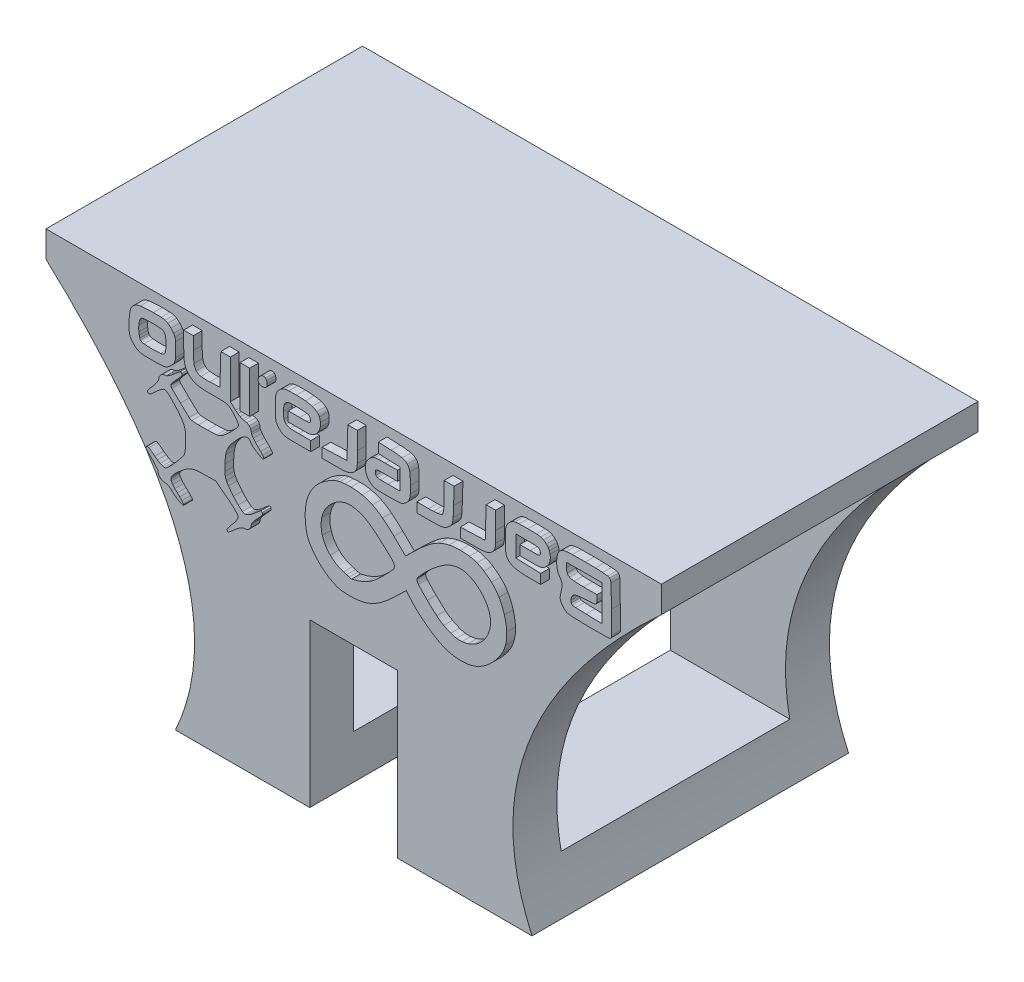
from build123d import *

# Parameters (mm, degrees)
CROQUIS1_W              = 30
CROQUIS1_H              = 18.5
SALIENTE_EXTRUIR1_DEPTH = 13
VACIADO2_T              = 2.5
CROQUIS2_W              = 5
CROQUIS2_H              = 9.25
CORTAR_EXTRUIR1_DEPTH   = 33
CROQUIS3_W              = 35
CROQUIS3_H              = 18
SALIENTE_EXTRUIR2_DEPTH = 1.5
CROQUIS4_W              = 13
CROQUIS4_H              = 17
CORTAR_EXTRUIR2_DEPTH   = 36.5
SALIENTE_EXTRUIR3_DEPTH = 0.5


with BuildPart() as part:
    # Croquis1 → Saliente-Extruir1 (new body)
    with BuildSketch(Plane.XY):
        Rectangle(CROQUIS1_W, CROQUIS1_H)
    extrude(amount=SALIENTE_EXTRUIR1_DEPTH)

    # Vaciado2
    vaciado2_openings = [part.faces().sort_by_distance(p)[0] for p in [
        (0, 9.25, 6.5),
    ]]
    offset(amount=VACIADO2_T, openings=vaciado2_openings, kind=Kind.INTERSECTION)

    # Croquis2 → Cortar-Extruir1 (cut)
    with BuildSketch(Plane(origin=(0, 0, -2.5), x_dir=(-1, 0, 0), z_dir=(0, 0, -1))):
        with Locations((0, -7.125)):
            Rectangle(CROQUIS2_W, CROQUIS2_H)
        with BuildLine():
            add(Edge.make_bspline(
                [(17.5, 7.75), (6.020580463, -2.775983449), (10.140099404, -11.75)],
                knots=[0, 0, 0, 0.85894238, 0.85894238, 0.85894238], degree=2))
            Line((10.140099404, -11.75), (17.5, -11.75))
            Line((17.5, -11.75), (17.5, 7.75))
        make_face()
        with BuildLine():
            Line((-17.5, -11.75), (-10.140099404, -11.75))
            add(Edge.make_bspline(
                [(-17.5, 7.75), (-6.020580463, -2.775983449), (-10.140099404, -11.75)],
                knots=[0, 0, 0, 0.85894238, 0.85894238, 0.85894238], degree=2))
            Line((-17.5, 7.75), (-17.5, -11.75))
        make_face()
    extrude(amount=-CORTAR_EXTRUIR1_DEPTH, mode=Mode.SUBTRACT)

    # Croquis3 → Saliente-Extruir2 (add)
    with BuildSketch(Plane(origin=(0, 9.25, 0), x_dir=(1, 0, 0), z_dir=(0, 1, 0))):
        with Locations((0, -6.5)):
            Rectangle(CROQUIS3_W, CROQUIS3_H)
    extrude(amount=-SALIENTE_EXTRUIR2_DEPTH)

    # Croquis4 → Cortar-Extruir2 (cut)
    with BuildSketch(Plane.ZY.offset(17.5)):
        with Locations((6.5, -0.75)):
            Rectangle(CROQUIS4_W, CROQUIS4_H)
    extrude(amount=-CORTAR_EXTRUIR2_DEPTH, mode=Mode.SUBTRACT)

    # Croquis5 → Saliente-Extruir3 (add)
    # profile 1 of 12: a face of its own
    with BuildSketch(Plane.XY.offset(15.5)):
        with BuildLine():
            Line((-6.726430196, 1.686888291), (-7.347587786, 2.160491987))
            Line((-7.347587786, 2.160491987), (-8.012612343, 2.150111901))
            ThreePointArc((-8.012612343, 2.150111901), (-8.249503026, 2.14025315), (-8.485561695, 2.1181015))
            ThreePointArc((-8.485561695, 2.1181015), (-8.648540759, 2.086370976), (-8.805198901, 2.031350726))
            ThreePointArc((-8.805198901, 2.031350726), (-8.96281718, 1.950373747), (-9.108788937, 1.849909626))
            ThreePointArc((-9.108788937, 1.849909626), (-9.328394875, 1.670920525), (-9.54180644, 1.484589178))
            ThreePointArc((-9.54180644, 1.484589178), (-9.612029303, 1.417976061), (-9.678931419, 1.348028476))
            ThreePointArc((-9.678931419, 1.348028476), (-9.738891455, 1.278335907), (-9.794803729, 1.205355924))
            ThreePointArc((-9.794803729, 1.205355924), (-9.837977704, 1.141728708), (-9.877364265, 1.075689981))
            ThreePointArc((-9.877364265, 1.075689981), (-9.894272975, 1.0335316), (-9.900032698, 0.988475423))
            ThreePointArc((-9.900032698, 0.988475423), (-9.894185201, 0.943216208), (-9.877026669, 0.900929396))
            ThreePointArc((-9.877026669, 0.900929396), (-9.836694506, 0.834050075), (-9.792590698, 0.769595587))
            ThreePointArc((-9.792590698, 0.769595587), (-9.73546608, 0.695501681), (-9.674284529, 0.624720702))
            ThreePointArc((-9.674284529, 0.624720702), (-9.605936838, 0.553469752), (-9.534272698, 0.485555423))
            ThreePointArc((-9.534272698, 0.485555423), (-9.463444228, 0.420052787), (-9.394159644, 0.352919234))
            ThreePointArc((-9.394159644, 0.352919234), (-9.334033523, 0.2913043), (-9.275954698, 0.227755888))
            ThreePointArc((-9.275954698, 0.227755888), (-9.229944999, 0.174390027), (-9.185293859, 0.119882383))
            ThreePointArc((-9.185293859, 0.119882383), (-9.172829293, 0.097350582), (-9.168512698, 0.071965262))
            ThreePointArc((-9.168512698, 0.071965262), (-9.186172515, 0.038125782), (-9.2240315, 0.033259899))
            ThreePointArc((-9.2240315, 0.033259899), (-9.328133027, 0.076013859), (-9.428836343, 0.126252002))
            ThreePointArc((-9.428836343, 0.126252002), (-9.548674314, 0.197072608), (-9.663347482, 0.275982441))
            ThreePointArc((-9.663347482, 0.275982441), (-9.758691073, 0.354145977), (-9.8458406, 0.441352047))
            ThreePointArc((-9.8458406, 0.441352047), (-9.884556396, 0.480126129), (-9.926885883, 0.514919185))
            ThreePointArc((-9.926885883, 0.514919185), (-9.975363087, 0.548008936), (-10.026327432, 0.577122616))
            ThreePointArc((-10.026327432, 0.577122616), (-10.076392804, 0.600545377), (-10.128226156, 0.619740971))
            ThreePointArc((-10.128226156, 0.619740971), (-10.17154802, 0.630109082), (-10.215956801, 0.633593583))
            ThreePointArc((-10.215956801, 0.633593583), (-10.295973509, 0.640353485), (-10.373722074, 0.660441556))
            ThreePointArc((-10.373722074, 0.660441556), (-10.44475892, 0.692905233), (-10.508698761, 0.737758556))
            ThreePointArc((-10.508698761, 0.737758556), (-10.559750331, 0.790552611), (-10.599429644, 0.85235089))
            ThreePointArc((-10.599429644, 0.85235089), (-10.623409168, 0.917255705), (-10.631552698, 0.985967681))
            ThreePointArc((-10.631552698, 0.985967681), (-10.637077188, 1.023601814), (-10.653184476, 1.058060532))
            ThreePointArc((-10.653184476, 1.058060532), (-10.698147326, 1.12333131), (-10.745709869, 1.186732705))
            ThreePointArc((-10.745709869, 1.186732705), (-10.806935048, 1.261586789), (-10.87135867, 1.333706503))
            ThreePointArc((-10.87135867, 1.333706503), (-10.944509659, 1.409493154), (-11.020172698, 1.482771991))
            ThreePointArc((-11.020172698, 1.482771991), (-11.164219655, 1.624416162), (-11.301171933, 1.772931045))
            ThreePointArc((-11.301171933, 1.772931045), (-11.321206676, 1.834012271), (-11.290947387, 1.890728076))
            ThreePointArc((-11.290947387, 1.890728076), (-11.222172075, 1.916701583), (-11.151339447, 1.897018966))
            ThreePointArc((-11.151339447, 1.897018966), (-10.979405574, 1.776962483), (-10.813036318, 1.64930636))
            ThreePointArc((-10.813036318, 1.64930636), (-10.740048208, 1.593270301), (-10.664646389, 1.540526867))
            ThreePointArc((-10.664646389, 1.540526867), (-10.589056137, 1.492708095), (-10.511244999, 1.448595194))
            ThreePointArc((-10.511244999, 1.448595194), (-10.443093644, 1.414231989), (-10.373336563, 1.383258022))
            ThreePointArc((-10.373336563, 1.383258022), (-10.328694271, 1.36969383), (-10.28226214, 1.365113583))
            ThreePointArc((-10.28226214, 1.365113583), (-10.204801303, 1.378938579), (-10.13690555, 1.418706384))
            ThreePointArc((-10.13690555, 1.418706384), (-10.007450004, 1.534101515), (-9.883090695, 1.654971433))
            ThreePointArc((-9.883090695, 1.654971433), (-9.721067406, 1.826245665), (-9.566168616, 2.003989227))
            ThreePointArc((-9.566168616, 2.003989227), (-9.370999793, 2.241873087), (-9.180307818, 2.483360501))
            ThreePointArc((-9.180307818, 2.483360501), (-9.149373135, 2.532818732), (-9.128894581, 2.587441989))
            ThreePointArc((-9.128894581, 2.587441989), (-9.10740439, 2.678353684), (-9.090749379, 2.770274166))
            ThreePointArc((-9.090749379, 2.770274166), (-9.075591326, 2.886819399), (-9.065918756, 3.003947531))
            ThreePointArc((-9.065918756, 3.003947531), (-9.059846744, 3.141257884), (-9.057822201, 3.278687515))
            ThreePointArc((-9.057822201, 3.278687515), (-9.060169294, 3.448186799), (-9.0672087, 3.617556109))
            ThreePointArc((-9.0672087, 3.617556109), (-9.078395109, 3.734045059), (-9.09893582, 3.84925309))
            ThreePointArc((-9.09893582, 3.84925309), (-9.125052934, 3.943642311), (-9.161037844, 4.034727517))
            ThreePointArc((-9.161037844, 4.034727517), (-9.208933013, 4.128503258), (-9.264670728, 4.217840506))
            ThreePointArc((-9.264670728, 4.217840506), (-9.391358994, 4.39350335), (-9.526398434, 4.56283055))
            ThreePointArc((-9.526398434, 4.56283055), (-9.672407828, 4.729280787), (-9.82580573, 4.888947653))
            ThreePointArc((-9.82580573, 4.888947653), (-9.964686603, 5.022163252), (-10.108320125, 5.150240196))
            ThreePointArc((-10.108320125, 5.150240196), (-10.178012497, 5.1913099), (-10.257634879, 5.205593583))
            ThreePointArc((-10.257634879, 5.205593583), (-10.295597991, 5.20065198), (-10.331031024, 5.186156548))
            ThreePointArc((-10.331031024, 5.186156548), (-10.393492967, 5.148712777), (-10.454226307, 5.108525817))
            ThreePointArc((-10.454226307, 5.108525817), (-10.525338304, 5.056700733), (-10.593995822, 5.001665284))
            ThreePointArc((-10.593995822, 5.001665284), (-10.665004686, 4.939713912), (-10.73364683, 4.875150088))
            ThreePointArc((-10.73364683, 4.875150088), (-10.88865626, 4.730140501), (-11.049732599, 4.591901155))
            ThreePointArc((-11.049732599, 4.591901155), (-11.117782387, 4.565180588), (-11.188559824, 4.583492241))
            ThreePointArc((-11.188559824, 4.583492241), (-11.22369964, 4.635679308), (-11.209351086, 4.696936271))
            ThreePointArc((-11.209351086, 4.696936271), (-11.083235549, 4.857848652), (-10.949755303, 5.012706481))
            ThreePointArc((-10.949755303, 5.012706481), (-10.88005007, 5.092961376), (-10.813535032, 5.175879515))
            ThreePointArc((-10.813535032, 5.175879515), (-10.753068258, 5.258047944), (-10.696293133, 5.342809178))
            ThreePointArc((-10.696293133, 5.342809178), (-10.651528671, 5.416472551), (-10.610050765, 5.492035326))
            ThreePointArc((-10.610050765, 5.492035326), (-10.591648549, 5.538326045), (-10.582967975, 5.58737826))
            ThreePointArc((-10.582967975, 5.58737826), (-10.570863279, 5.656240743), (-10.545258667, 5.721302015))
            ThreePointArc((-10.545258667, 5.721302015), (-10.506707491, 5.781531892), (-10.457582338, 5.833498713))
            ThreePointArc((-10.457582338, 5.833498713), (-10.398143986, 5.87672159), (-10.331877301, 5.908499904))
            ThreePointArc((-10.331877301, 5.908499904), (-10.2598337, 5.928442445), (-10.185435318, 5.935713362))
            ThreePointArc((-10.185435318, 5.935713362), (-10.149327985, 5.940777687), (-10.115686532, 5.954836118))
            ThreePointArc((-10.115686532, 5.954836118), (-10.050741673, 5.993934329), (-9.987231894, 6.035322886))
            ThreePointArc((-9.987231894, 6.035322886), (-9.91219059, 6.088314191), (-9.839268075, 6.144185315))
            ThreePointArc((-9.839268075, 6.144185315), (-9.762517787, 6.207349711), (-9.687745229, 6.272843315))
            ThreePointArc((-9.687745229, 6.272843315), (-9.539370816, 6.400146815), (-9.384676127, 6.519690533))
            ThreePointArc((-9.384676127, 6.519690533), (-9.325151221, 6.531669758), (-9.277515671, 6.494019119))
            ThreePointArc((-9.277515671, 6.494019119), (-9.263865717, 6.419083587), (-9.293239053, 6.348806547))
            ThreePointArc((-9.293239053, 6.348806547), (-9.42794755, 6.190912838), (-9.569589204, 6.039207714))
            ThreePointArc((-9.569589204, 6.039207714), (-9.633808642, 5.971604484), (-9.696143261, 5.902259489))
            ThreePointArc((-9.696143261, 5.902259489), (-9.750758501, 5.83743708), (-9.802964932, 5.770659407))
            ThreePointArc((-9.802964932, 5.770659407), (-9.843878597, 5.714484389), (-9.88300209, 5.657048225))
            ThreePointArc((-9.88300209, 5.657048225), (-9.895683559, 5.629876162), (-9.900032698, 5.600207566))
            ThreePointArc((-9.900032698, 5.600207566), (-9.886329748, 5.531952861), (-9.847344513, 5.474275941))
            ThreePointArc((-9.847344513, 5.474275941), (-9.601772764, 5.234230447), (-9.354162873, 4.99628788))
            ThreePointArc((-9.354162873, 4.99628788), (-9.107653184, 4.763801288), (-8.858786856, 4.533839133))
            ThreePointArc((-8.858786856, 4.533839133), (-8.787906287, 4.486526353), (-8.706100618, 4.462643583))
            ThreePointArc((-8.706100618, 4.462643583), (-8.518661181, 4.443186172), (-8.330420293, 4.434382679))
            ThreePointArc((-8.330420293, 4.434382679), (-8.069399251, 4.432452894), (-7.808398843, 4.436260125))
            ThreePointArc((-7.808398843, 4.436260125), (-7.551507179, 4.444683661), (-7.294763538, 4.456807425))
            ThreePointArc((-7.294763538, 4.456807425), (-7.203425185, 4.471074218), (-7.116777589, 4.503298904))
            ThreePointArc((-7.116777589, 4.503298904), (-6.977713068, 4.583135737), (-6.850083411, 4.680210615))
            ThreePointArc((-6.850083411, 4.680210615), (-6.659895887, 4.851094722), (-6.475695407, 5.028416056))
            ThreePointArc((-6.475695407, 5.028416056), (-6.296166188, 5.211477379), (-6.120922746, 5.398645551))
            ThreePointArc((-6.120922746, 5.398645551), (-6.075433904, 5.471899601), (-6.059552698, 5.556653231))
            ThreePointArc((-6.059552698, 5.556653231), (-6.064147052, 5.594820361), (-6.077667511, 5.630806956))
            ThreePointArc((-6.077667511, 5.630806956), (-6.110058622, 5.689434911), (-6.145403337, 5.746331064))
            ThreePointArc((-6.145403337, 5.746331064), (-6.191031108, 5.812062516), (-6.239932363, 5.875396429))
            ThreePointArc((-6.239932363, 5.875396429), (-6.294502779, 5.939584079), (-6.351810209, 6.001340399))
            ThreePointArc((-6.351810209, 6.001340399), (-6.449640825, 6.095655295), (-6.553638772, 6.183122753))
            ThreePointArc((-6.553638772, 6.183122753), (-6.631685329, 6.232311153), (-6.718142989, 6.264495575))
            ThreePointArc((-6.718142989, 6.264495575), (-6.832956895, 6.287256057), (-6.94962719, 6.296653651))
            ThreePointArc((-6.94962719, 6.296653651), (-7.233630392, 6.301519358), (-7.517670209, 6.303215386))
            ThreePointArc((-7.517670209, 6.303215386), (-7.751220964, 6.305245186), (-7.984705861, 6.311150915))
            ThreePointArc((-7.984705861, 6.311150915), (-8.132585481, 6.320607804), (-8.279621807, 6.338996223))
            ThreePointArc((-8.279621807, 6.338996223), (-8.389260838, 6.361338656), (-8.496361673, 6.39373175))
            ThreePointArc((-8.496361673, 6.39373175), (-8.595945423, 6.434889233), (-8.690731932, 6.486137448))
            ThreePointArc((-8.690731932, 6.486137448), (-8.819644825, 6.578721697), (-8.933205757, 6.689601323))
            ThreePointArc((-8.933205757, 6.689601323), (-9.017449904, 6.806980355), (-9.076821604, 6.938699428))
            ThreePointArc((-9.076821604, 6.938699428), (-9.124572061, 7.118702613), (-9.148714384, 7.303360137))
            ThreePointArc((-9.148714384, 7.303360137), (-9.163561834, 7.60603148), (-9.168512698, 7.909026327))
            Line((-9.168512698, 7.909026327), (-9.168512698, 8.680313583))
            Line((-9.168512698, 8.680313583), (-8.894192698, 8.680313583))
            Line((-8.894192698, 8.680313583), (-8.619872698, 8.680313583))
            Line((-8.619872698, 8.680313583), (-8.619872698, 7.948793583))
            ThreePointArc((-8.619872698, 7.948793583), (-8.611386763, 7.639308202), (-8.585954768, 7.330752817))
            ThreePointArc((-8.585954768, 7.330752817), (-8.543080758, 7.170641895), (-8.454248067, 7.030704619))
            ThreePointArc((-8.454248067, 7.030704619), (-8.334805159, 6.935866274), (-8.189413686, 6.889798505))
            ThreePointArc((-8.189413686, 6.889798505), (-7.934311304, 6.86893362), (-7.678359824, 6.870120708))
            Line((-7.678359824, 6.870120708), (-7.111112698, 6.897233583))
            Line((-7.111112698, 6.897233583), (-7.084941473, 7.788773583))
            Line((-7.084941473, 7.788773583), (-7.058770248, 8.680313583))
            Line((-7.058770248, 8.680313583), (-6.787761473, 8.680313583))
            Line((-6.787761473, 8.680313583), (-6.516752698, 8.680313583))
            Line((-6.516752698, 8.680313583), (-6.516752698, 7.581744645))
            Line((-6.516752698, 7.581744645), (-6.516752698, 6.483175615))
            Line((-6.516752698, 6.483175615), (-6.219572698, 6.212825025))
            ThreePointArc((-6.219572698, 6.212825025), (-6.157243177, 6.159216259), (-6.092026974, 6.109159132))
            ThreePointArc((-6.092026974, 6.109159132), (-6.024578522, 6.063176622), (-5.954625298, 6.021102503))
            ThreePointArc((-5.954625298, 6.021102503), (-5.891762313, 5.98810266), (-5.827054063, 5.958886453))
            ThreePointArc((-5.827054063, 5.958886453), (-5.781907395, 5.944949763), (-5.734940698, 5.939793964))
            ThreePointArc((-5.734940698, 5.939793964), (-5.654280452, 5.931581424), (-5.576267427, 5.909502269))
            ThreePointArc((-5.576267427, 5.909502269), (-5.506510001, 5.874840642), (-5.44485562, 5.827235347))
            ThreePointArc((-5.44485562, 5.827235347), (-5.395359094, 5.770007198), (-5.35848551, 5.703936737))
            ThreePointArc((-5.35848551, 5.703936737), (-5.335725298, 5.631707273), (-5.328032698, 5.556368396))
            ThreePointArc((-5.328032698, 5.556368396), (-5.322101806, 5.512615663), (-5.30473717, 5.472020756))
            ThreePointArc((-5.30473717, 5.472020756), (-5.261071899, 5.402947323), (-5.214036371, 5.336123268))
            ThreePointArc((-5.214036371, 5.336123268), (-5.153197271, 5.258242781), (-5.088534514, 5.183506617))
            ThreePointArc((-5.088534514, 5.183506617), (-5.015786434, 5.106777523), (-4.939960058, 5.033089005))
            ThreePointArc((-4.939960058, 5.033089005), (-4.866715042, 4.962564958), (-4.795739976, 4.889756897))
            ThreePointArc((-4.795739976, 4.889756897), (-4.738388678, 4.825762352), (-4.684455576, 4.758861725))
            ThreePointArc((-4.684455576, 4.758861725), (-4.645980229, 4.705885116), (-4.610117416, 4.651106178))
            ThreePointArc((-4.610117416, 4.651106178), (-4.605084262, 4.628621342), (-4.615110406, 4.607875815))
            ThreePointArc((-4.615110406, 4.607875815), (-4.665250543, 4.58215894), (-4.720976346, 4.590527086))
            ThreePointArc((-4.720976346, 4.590527086), (-4.85936255, 4.663280939), (-4.994180504, 4.742451537))
            ThreePointArc((-4.994180504, 4.742451537), (-5.127137093, 4.830092606), (-5.254917915, 4.925121408))
            ThreePointArc((-5.254917915, 4.925121408), (-5.318159768, 4.9904894), (-5.361809903, 5.070283963))
            ThreePointArc((-5.361809903, 5.070283963), (-5.402771299, 5.13465035), (-5.46559348, 5.177942858))
            ThreePointArc((-5.46559348, 5.177942858), (-5.543969178, 5.19639611), (-5.623979722, 5.187363647))
            ThreePointArc((-5.623979722, 5.187363647), (-5.733578119, 5.143744045), (-5.833025003, 5.080302769))
            ThreePointArc((-5.833025003, 5.080302769), (-5.956806455, 4.976016566), (-6.072371855, 4.862693583))
            ThreePointArc((-6.072371855, 4.862693583), (-6.273065482, 4.642536428), (-6.465580588, 4.415192989))
            ThreePointArc((-6.465580588, 4.415192989), (-6.579524065, 4.256665363), (-6.673275576, 4.085420573))
            ThreePointArc((-6.673275576, 4.085420573), (-6.738240261, 3.917399205), (-6.778841135, 3.741890917))
            ThreePointArc((-6.778841135, 3.741890917), (-6.809037884, 3.503510702), (-6.824633099, 3.263732138))
            ThreePointArc((-6.824633099, 3.263732138), (-6.828971175, 3.074640761), (-6.828965252, 2.88549963))
            ThreePointArc((-6.828965252, 2.88549963), (-6.822207223, 2.771696803), (-6.804617614, 2.65905862))
            ThreePointArc((-6.804617614, 2.65905862), (-6.779289457, 2.567091012), (-6.742071191, 2.479259599))
            ThreePointArc((-6.742071191, 2.479259599), (-6.685862107, 2.377196887), (-6.622346513, 2.279513583))
            ThreePointArc((-6.622346513, 2.279513583), (-6.485783864, 2.093106177), (-6.342171884, 1.912073921))
            ThreePointArc((-6.342171884, 1.912073921), (-6.210747514, 1.76209909), (-6.070637695, 1.620204574))
            ThreePointArc((-6.070637695, 1.620204574), (-5.953908276, 1.515903593), (-5.830602666, 1.419466159))
            ThreePointArc((-5.830602666, 1.419466159), (-5.751663087, 1.379045566), (-5.664077807, 1.365113583))
            ThreePointArc((-5.664077807, 1.365113583), (-5.617079884, 1.370418545), (-5.572447064, 1.38606651))
            ThreePointArc((-5.572447064, 1.38606651), (-5.500308599, 1.423124456), (-5.430108176, 1.463734183))
            ThreePointArc((-5.430108176, 1.463734183), (-5.349202518, 1.516063606), (-5.270982277, 1.572328053))
            ThreePointArc((-5.270982277, 1.572328053), (-5.19197521, 1.634908425), (-5.115745229, 1.700843315))
            ThreePointArc((-5.115745229, 1.700843315), (-4.967370816, 1.828146815), (-4.812676127, 1.947690533))
            ThreePointArc((-4.812676127, 1.947690533), (-4.753151221, 1.959669758), (-4.705515671, 1.922019119))
            ThreePointArc((-4.705515671, 1.922019119), (-4.691865717, 1.847083587), (-4.721239053, 1.776806547))
            ThreePointArc((-4.721239053, 1.776806547), (-4.85594755, 1.618912838), (-4.997589204, 1.467207714))
            ThreePointArc((-4.997589204, 1.467207714), (-5.062155635, 1.39855797), (-5.124104216, 1.327536955))
            ThreePointArc((-5.124104216, 1.327536955), (-5.179142607, 1.258851378), (-5.230964932, 1.187708004))
            ThreePointArc((-5.230964932, 1.187708004), (-5.271148461, 1.126939283), (-5.308581856, 1.064438929))
            ThreePointArc((-5.308581856, 1.064438929), (-5.323087737, 1.028947432), (-5.328032698, 0.990926198))
            ThreePointArc((-5.328032698, 0.990926198), (-5.335871658, 0.922362657), (-5.358984041, 0.857337845))
            ThreePointArc((-5.358984041, 0.857337845), (-5.397329623, 0.794882571), (-5.446810515, 0.740820699))
            ThreePointArc((-5.446810515, 0.740820699), (-5.507678501, 0.695186359), (-5.575801449, 0.66132386))
            ThreePointArc((-5.575801449, 0.66132386), (-5.648542524, 0.640585933), (-5.723858079, 0.633593583))
            ThreePointArc((-5.723858079, 0.633593583), (-5.770295424, 0.628472999), (-5.814501362, 0.613357362))
            ThreePointArc((-5.814501362, 0.613357362), (-5.884444119, 0.578253921), (-5.952478744, 0.539581833))
            ThreePointArc((-5.952478744, 0.539581833), (-6.030509686, 0.489770185), (-6.105908847, 0.436058037))
            ThreePointArc((-6.105908847, 0.436058037), (-6.181574441, 0.376483328), (-6.254473518, 0.313553583))
            ThreePointArc((-6.254473518, 0.313553583), (-6.377887812, 0.203390679), (-6.502611868, 0.094712883))
            ThreePointArc((-6.502611868, 0.094712883), (-6.55795652, 0.052482437), (-6.61788607, 0.017058011))
            ThreePointArc((-6.61788607, 0.017058011), (-6.646606596, 0.012090835), (-6.673026859, 0.02439982))
            ThreePointArc((-6.673026859, 0.02439982), (-6.692685554, 0.051740208), (-6.699632698, 0.084690144))
            ThreePointArc((-6.699632698, 0.084690144), (-6.695615621, 0.112458461), (-6.683893771, 0.137949921))
            ThreePointArc((-6.683893771, 0.137949921), (-6.644414392, 0.197257583), (-6.603448334, 0.255548253))
            ThreePointArc((-6.603448334, 0.255548253), (-6.551612151, 0.325024103), (-6.497611563, 0.392831331))
            ThreePointArc((-6.497611563, 0.392831331), (-6.43574803, 0.466293109), (-6.372196483, 0.53829957))
            ThreePointArc((-6.372196483, 0.53829957), (-6.308823883, 0.611929055), (-6.24906347, 0.688519396))
            ThreePointArc((-6.24906347, 0.688519396), (-6.197205156, 0.762879131), (-6.149832325, 0.840173825))
            ThreePointArc((-6.149832325, 0.840173825), (-6.114709627, 0.906047143), (-6.083658477, 0.973934726))
            ThreePointArc((-6.083658477, 0.973934726), (-6.073168136, 1.01482979), (-6.075016483, 1.057008423))
            ThreePointArc((-6.075016483, 1.057008423), (-6.090617796, 1.102561395), (-6.118099627, 1.142099012))
            ThreePointArc((-6.118099627, 1.142099012), (-6.197322674, 1.225425813), (-6.278849959, 1.306499537))
            ThreePointArc((-6.278849959, 1.306499537), (-6.381017239, 1.402033429), (-6.486324301, 1.494094823))
            ThreePointArc((-6.486324301, 1.494094823), (-6.605166699, 1.591999182), (-6.726430196, 1.686888291))
        make_face()
    # profile 2 of 12: a face of its own
    with BuildSketch(Plane.XY.offset(15.5)):
        with BuildLine():
            Line((3.842602676, 1.768036536), (3.483555195, 2.17593602))
            Line((3.483555195, 2.17593602), (2.80129502, 1.519064801))
            ThreePointArc((2.80129502, 1.519064801), (2.47717796, 1.222435938), (2.138474624, 0.942577755))
            ThreePointArc((2.138474624, 0.942577755), (1.858047487, 0.745420356), (1.558509017, 0.578725651))
            ThreePointArc((1.558509017, 0.578725651), (1.276941792, 0.461889399), (0.983082584, 0.380787129))
            ThreePointArc((0.983082584, 0.380787129), (0.663895864, 0.330874242), (0.341247302, 0.314461948))
            ThreePointArc((0.341247302, 0.314461948), (0.146585654, 0.317476445), (-0.04791256, 0.326002224))
            ThreePointArc((-0.04791256, 0.326002224), (-0.180137366, 0.339336246), (-0.310750988, 0.363857196))
            ThreePointArc((-0.310750988, 0.363857196), (-0.430762356, 0.397806749), (-0.547005888, 0.443003453))
            ThreePointArc((-0.547005888, 0.443003453), (-0.695253009, 0.512755189), (-0.840382075, 0.588781948))
            ThreePointArc((-0.840382075, 0.588781948), (-1.048096448, 0.717201042), (-1.24201353, 0.865635842))
            ThreePointArc((-1.24201353, 0.865635842), (-1.44111682, 1.047491464), (-1.626213686, 1.243585159))
            ThreePointArc((-1.626213686, 1.243585159), (-1.792499946, 1.448400438), (-1.942941089, 1.665121182))
            ThreePointArc((-1.942941089, 1.665121182), (-2.05368932, 1.862970229), (-2.140406501, 2.072468551))
            ThreePointArc((-2.140406501, 2.072468551), (-2.166854172, 2.15952468), (-2.18651064, 2.248360889))
            ThreePointArc((-2.18651064, 2.248360889), (-2.207735735, 2.375701587), (-2.225385625, 2.503586846))
            ThreePointArc((-2.225385625, 2.503586846), (-2.240892292, 2.644832072), (-2.252497127, 2.786451274))
            ThreePointArc((-2.252497127, 2.786451274), (-2.259524216, 2.921524615), (-2.262228629, 3.056753583))
            ThreePointArc((-2.262228629, 3.056753583), (-2.238545943, 3.437941304), (-2.164858197, 3.812687971))
            ThreePointArc((-2.164858197, 3.812687971), (-2.044471291, 4.15818284), (-1.873754568, 4.481780603))
            ThreePointArc((-1.873754568, 4.481780603), (-1.653072433, 4.781996565), (-1.390875655, 5.046728653))
            ThreePointArc((-1.390875655, 5.046728653), (-1.074105152, 5.291357195), (-0.730630301, 5.496812061))
            ThreePointArc((-0.730630301, 5.496812061), (-0.620860461, 5.549180184), (-0.507726098, 5.593817099))
            ThreePointArc((-0.507726098, 5.593817099), (-0.395206021, 5.629002417), (-0.280336124, 5.655529406))
            ThreePointArc((-0.280336124, 5.655529406), (-0.146724751, 5.676744559), (-0.012044672, 5.689525701))
            ThreePointArc((-0.012044672, 5.689525701), (0.164513859, 5.698158563), (0.341247302, 5.701726632))
            ThreePointArc((0.341247302, 5.701726632), (0.666019568, 5.686752583), (0.987489717, 5.638191377))
            ThreePointArc((0.987489717, 5.638191377), (1.281798583, 5.558406505), (1.563776327, 5.442338052))
            ThreePointArc((1.563776327, 5.442338052), (1.860880885, 5.277223913), (2.138503885, 5.081113568))
            ThreePointArc((2.138503885, 5.081113568), (2.470006851, 4.804421517), (2.786304987, 4.510468806))
            Line((2.786304987, 4.510468806), (3.448778277, 3.861064121))
            Line((3.448778277, 3.861064121), (4.117848415, 4.510468806))
            ThreePointArc((4.117848415, 4.510468806), (4.436245517, 4.803856455), (4.769429555, 5.080336876))
            ThreePointArc((4.769429555, 5.080336876), (5.04713457, 5.275985089), (5.343968381, 5.44117585))
            ThreePointArc((5.343968381, 5.44117585), (5.624583776, 5.557433002), (5.917439187, 5.63803346))
            ThreePointArc((5.917439187, 5.63803346), (6.236585729, 5.687834578), (6.559167302, 5.704441668))
            ThreePointArc((6.559167302, 5.704441668), (6.820015631, 5.695220615), (7.07957511, 5.667729605))
            ThreePointArc((7.07957511, 5.667729605), (7.296559942, 5.624222919), (7.507150836, 5.556202889))
            ThreePointArc((7.507150836, 5.556202889), (7.71198317, 5.463347489), (7.905170502, 5.348208162))
            ThreePointArc((7.905170502, 5.348208162), (8.125887751, 5.188902611), (8.336039531, 5.015898011))
            ThreePointArc((8.336039531, 5.015898011), (8.572724922, 4.769879123), (8.764829032, 4.487671259))
            ThreePointArc((8.764829032, 4.487671259), (8.93626785, 4.138437082), (9.066772233, 3.771934169))
            ThreePointArc((9.066772233, 3.771934169), (9.155316075, 3.390535089), (9.200026831, 3.001554089))
            ThreePointArc((9.200026831, 3.001554089), (9.192066647, 2.653313248), (9.128412668, 2.31084687))
            ThreePointArc((9.128412668, 2.31084687), (9.018269479, 1.996929781), (8.863501113, 1.702443424))
            ThreePointArc((8.863501113, 1.702443424), (8.650325372, 1.397066168), (8.406411847, 1.115631704))
            ThreePointArc((8.406411847, 1.115631704), (8.136657183, 0.863478274), (7.841881404, 0.64109084))
            ThreePointArc((7.841881404, 0.64109084), (7.560289528, 0.481442931), (7.257338219, 0.367416863))
            ThreePointArc((7.257338219, 0.367416863), (7.082058757, 0.324699233), (6.903755558, 0.297210054))
            ThreePointArc((6.903755558, 0.297210054), (6.711777957, 0.282885453), (6.519267915, 0.282194783))
            ThreePointArc((6.519267915, 0.282194783), (6.323965252, 0.295255481), (6.130049897, 0.321911565))
            ThreePointArc((6.130049897, 0.321911565), (5.944373133, 0.361446529), (5.762262855, 0.415062956))
            ThreePointArc((5.762262855, 0.415062956), (5.531293292, 0.505592317), (5.31027969, 0.618266593))
            ThreePointArc((5.31027969, 0.618266593), (5.037303977, 0.783308747), (4.772341462, 0.960930586))
            ThreePointArc((4.772341462, 0.960930586), (4.506671112, 1.157558947), (4.250411086, 1.3663034))
            ThreePointArc((4.250411086, 1.3663034), (4.039361455, 1.559916484), (3.842602676, 1.768036536))
        make_face()
        with BuildLine():
            Line((0.243084998, 1.22453775), (0.373876751, 1.189035347))
            ThreePointArc((0.373876751, 1.189035347), (0.377701759, 1.189216201), (0.380703753, 1.191593473))
            ThreePointArc((0.380703753, 1.191593473), (0.383613842, 1.194598067), (0.387394692, 1.196387306))
            ThreePointArc((0.387394692, 1.196387306), (0.428798696, 1.20746585), (0.470221958, 1.218472169))
            ThreePointArc((0.470221958, 1.218472169), (0.517638612, 1.230831733), (0.565148931, 1.242826207))
            ThreePointArc((0.565148931, 1.242826207), (0.620867281, 1.256522944), (0.676650867, 1.269951518))
            ThreePointArc((0.676650867, 1.269951518), (0.746696626, 1.289014282), (0.81538519, 1.312502116))
            ThreePointArc((0.81538519, 1.312502116), (0.906980041, 1.348501795), (0.99759905, 1.386891756))
            ThreePointArc((0.99759905, 1.386891756), (1.094168185, 1.430801366), (1.189570929, 1.477190676))
            ThreePointArc((1.189570929, 1.477190676), (1.27677107, 1.52277427), (1.362450867, 1.571155061))
            ThreePointArc((1.362450867, 1.571155061), (1.563812255, 1.702692291), (1.751507493, 1.853088263))
            ThreePointArc((1.751507493, 1.853088263), (2.007936467, 2.087560276), (2.256369953, 2.330487725))
            ThreePointArc((2.256369953, 2.330487725), (2.496502387, 2.578434767), (2.731391244, 2.831354806))
            ThreePointArc((2.731391244, 2.831354806), (2.789757798, 2.925812381), (2.810127302, 3.034963522))
            ThreePointArc((2.810127302, 3.034963522), (2.784239827, 3.163449378), (2.710616807, 3.27188566))
            ThreePointArc((2.710616807, 3.27188566), (2.419894994, 3.550374318), (2.122786995, 3.822039449))
            ThreePointArc((2.122786995, 3.822039449), (1.816478915, 4.08588767), (1.500861675, 4.33852631))
            ThreePointArc((1.500861675, 4.33852631), (1.277371066, 4.491451149), (1.037956825, 4.618001057))
            ThreePointArc((1.037956825, 4.618001057), (0.773195029, 4.717689069), (0.497208188, 4.77988049))
            ThreePointArc((0.497208188, 4.77988049), (0.243795617, 4.794312749), (-0.007747266, 4.760365731))
            ThreePointArc((-0.007747266, 4.760365731), (-0.253167021, 4.678334216), (-0.479205688, 4.552371735))
            ThreePointArc((-0.479205688, 4.552371735), (-0.712577346, 4.369919654), (-0.921491275, 4.15990522))
            ThreePointArc((-0.921491275, 4.15990522), (-1.167665334, 3.796187052), (-1.315763365, 3.382714506))
            ThreePointArc((-1.315763365, 3.382714506), (-1.355900303, 2.946660277), (-1.285500474, 2.514458787))
            ThreePointArc((-1.285500474, 2.514458787), (-1.108536561, 2.111517625), (-0.836883581, 1.765277151))
            ThreePointArc((-0.836883581, 1.765277151), (-0.485603392, 1.494319009), (-0.078990182, 1.316887944))
            ThreePointArc((-0.078990182, 1.316887944), (0.00810866, 1.291224152), (0.095316038, 1.265931632))
            ThreePointArc((0.095316038, 1.265931632), (0.169127789, 1.244975061), (0.243084998, 1.22453775))
        make_face(mode=Mode.SUBTRACT)
        with BuildLine():
            ThreePointArc((7.004763566, 1.322817188), (7.181590832, 1.387364997), (7.350101905, 1.471259695))
            ThreePointArc((7.350101905, 1.471259695), (7.511157322, 1.574744372), (7.660308173, 1.694752497))
            ThreePointArc((7.660308173, 1.694752497), (7.798601941, 1.832354366), (7.921824744, 1.983601124))
            ThreePointArc((7.921824744, 1.983601124), (8.030956157, 2.149431954), (8.123169589, 2.325233583))
            ThreePointArc((8.123169589, 2.325233583), (8.215081962, 2.570731416), (8.269089815, 2.827246955))
            ThreePointArc((8.269089815, 2.827246955), (8.280865052, 3.07842324), (8.249823499, 3.327952004))
            ThreePointArc((8.249823499, 3.327952004), (8.175331101, 3.576895028), (8.061341976, 3.810407824))
            ThreePointArc((8.061341976, 3.810407824), (7.901142283, 4.045475654), (7.712929058, 4.258774994))
            ThreePointArc((7.712929058, 4.258774994), (7.404481657, 4.512116945), (7.052686629, 4.700696376))
            ThreePointArc((7.052686629, 4.700696376), (6.710591256, 4.789720588), (6.357211089, 4.780944943))
            ThreePointArc((6.357211089, 4.780944943), (5.956970867, 4.669304602), (5.589757638, 4.474856035))
            ThreePointArc((5.589757638, 4.474856035), (5.133130719, 4.136435787), (4.707507302, 3.759764694))
            ThreePointArc((4.707507302, 3.759764694), (4.588171367, 3.642401221), (4.471033586, 3.522843745))
            ThreePointArc((4.471033586, 3.522843745), (4.369850381, 3.414777054), (4.271595631, 3.304041084))
            ThreePointArc((4.271595631, 3.304041084), (4.192613552, 3.210896588), (4.115332077, 3.116336344))
            ThreePointArc((4.115332077, 3.116336344), (4.096730859, 3.082853877), (4.090287302, 3.045097269))
            ThreePointArc((4.090287302, 3.045097269), (4.11247673, 2.927360839), (4.176000506, 2.82577852))
            ThreePointArc((4.176000506, 2.82577852), (4.426079945, 2.560656379), (4.681973413, 2.301141429))
            ThreePointArc((4.681973413, 2.301141429), (4.94555957, 2.04849159), (5.217643838, 1.80501725))
            ThreePointArc((5.217643838, 1.80501725), (5.408977514, 1.65744828), (5.615570967, 1.532131395))
            ThreePointArc((5.615570967, 1.532131395), (5.813108384, 1.433707814), (6.01569421, 1.346145178))
            ThreePointArc((6.01569421, 1.346145178), (6.177436311, 1.29200379), (6.344345298, 1.256887028))
            ThreePointArc((6.344345298, 1.256887028), (6.500619649, 1.243735412), (6.657271632, 1.251137738))
            ThreePointArc((6.657271632, 1.251137738), (6.832642536, 1.279099994), (7.004763566, 1.322817188))
        make_face(mode=Mode.SUBTRACT)
    # profile 3 of 12: a face of its own
    with BuildSketch(Plane.XY.offset(15.5)):
        with BuildLine():
            Line((10.586683707, 7.125833583), (9.942447302, 7.125833583))
            Line((9.942447302, 7.125833583), (9.942447302, 7.400153583))
            Line((9.942447302, 7.400153583), (9.942447302, 7.674473583))
            Line((9.942447302, 7.674473583), (10.543167045, 7.674473583))
            ThreePointArc((10.543167045, 7.674473583), (10.731052957, 7.675590778), (10.918912293, 7.67894253))
            ThreePointArc((10.918912293, 7.67894253), (10.9871313, 7.686078785), (11.053326167, 7.704050948))
            ThreePointArc((11.053326167, 7.704050948), (11.088330836, 7.727445709), (11.108310319, 7.764505955))
            ThreePointArc((11.108310319, 7.764505955), (11.11717548, 7.822047349), (11.114667045, 7.880213583))
            ThreePointArc((11.114667045, 7.880213583), (11.099299636, 7.93963883), (11.071118379, 7.994167117))
            ThreePointArc((11.071118379, 7.994167117), (11.034722878, 8.032124218), (10.987499608, 8.055261564))
            ThreePointArc((10.987499608, 8.055261564), (10.904467743, 8.073487826), (10.819787218, 8.080950809))
            ThreePointArc((10.819787218, 8.080950809), (10.609732153, 8.084702952), (10.399647302, 8.085953583))
            Line((10.399647302, 8.085953583), (9.713847302, 8.085953583))
            Line((9.713847302, 8.085953583), (9.713847302, 7.491593583))
            Line((9.713847302, 7.491593583), (9.713847302, 6.897233583))
            Line((9.713847302, 6.897233583), (10.422507302, 6.870527251))
            Line((10.422507302, 6.870527251), (11.131167302, 6.843820827))
            Line((11.131167302, 6.843820827), (11.131167302, 6.573347251))
            Line((11.131167302, 6.573347251), (11.131167302, 6.302873583))
            Line((11.131167302, 6.302873583), (10.440826391, 6.302873583))
            ThreePointArc((10.440826391, 6.302873583), (10.288795934, 6.30509742), (10.136895559, 6.311766854))
            ThreePointArc((10.136895559, 6.311766854), (10.001262182, 6.322489029), (9.866178478, 6.338730041))
            ThreePointArc((9.866178478, 6.338730041), (9.754128874, 6.357149926), (9.643039823, 6.380679239))
            ThreePointArc((9.643039823, 6.380679239), (9.565692742, 6.404015497), (9.491787182, 6.436651674))
            ThreePointArc((9.491787182, 6.436651674), (9.385697383, 6.501080398), (9.28940431, 6.579398658))
            ThreePointArc((9.28940431, 6.579398658), (9.224465598, 6.657229919), (9.180639722, 6.748630324))
            ThreePointArc((9.180639722, 6.748630324), (9.146635837, 6.880023557), (9.131233227, 7.014868674))
            ThreePointArc((9.131233227, 7.014868674), (9.12242416, 7.281844059), (9.119487302, 7.548948591))
            ThreePointArc((9.119487302, 7.548948591), (9.121398423, 7.744849124), (9.127131228, 7.940675082))
            ThreePointArc((9.127131228, 7.940675082), (9.136821452, 8.048153288), (9.157383055, 8.154090465))
            ThreePointArc((9.157383055, 8.154090465), (9.183920959, 8.232809429), (9.223035969, 8.306096206))
            ThreePointArc((9.223035969, 8.306096206), (9.27949975, 8.38419866), (9.343930896, 8.455869988))
            ThreePointArc((9.343930896, 8.455869988), (9.418789001, 8.522482062), (9.500879244, 8.57994593))
            ThreePointArc((9.500879244, 8.57994593), (9.579417073, 8.619520091), (9.663556856, 8.645109183))
            ThreePointArc((9.663556856, 8.645109183), (9.78356249, 8.664939236), (9.90487744, 8.673729354))
            ThreePointArc((9.90487744, 8.673729354), (10.152240465, 8.678667568), (10.399647302, 8.680313583))
            ThreePointArc((10.399647302, 8.680313583), (10.647054138, 8.678667568), (10.894417163, 8.673729354))
            ThreePointArc((10.894417163, 8.673729354), (11.015732113, 8.664939236), (11.135737747, 8.645109183))
            ThreePointArc((11.135737747, 8.645109183), (11.21987753, 8.619520091), (11.298415359, 8.57994593))
            ThreePointArc((11.298415359, 8.57994593), (11.380505602, 8.522482062), (11.455363707, 8.455869988))
            ThreePointArc((11.455363707, 8.455869988), (11.508367948, 8.397875133), (11.555953833, 8.335357646))
            ThreePointArc((11.555953833, 8.335357646), (11.59437533, 8.272785975), (11.62569567, 8.206374668))
            ThreePointArc((11.62569567, 8.206374668), (11.649832407, 8.13622622), (11.666225444, 8.063875303))
            ThreePointArc((11.666225444, 8.063875303), (11.676405832, 7.983760728), (11.679807302, 7.903073583))
            ThreePointArc((11.679807302, 7.903073583), (11.676405832, 7.822386437), (11.666225444, 7.742271862))
            ThreePointArc((11.666225444, 7.742271862), (11.649832407, 7.669920946), (11.62569567, 7.599772498))
            ThreePointArc((11.62569567, 7.599772498), (11.59437533, 7.53336119), (11.555953833, 7.47078952))
            ThreePointArc((11.555953833, 7.47078952), (11.508367948, 7.408272032), (11.455363707, 7.350277178))
            ThreePointArc((11.455363707, 7.350277178), (11.384634563, 7.286533778), (11.307681157, 7.23046234))
            ThreePointArc((11.307681157, 7.23046234), (11.235706587, 7.191464093), (11.158371616, 7.164621882))
            ThreePointArc((11.158371616, 7.164621882), (11.056128006, 7.143835367), (10.952273445, 7.133832114))
            ThreePointArc((10.952273445, 7.133832114), (10.76952232, 7.127833438), (10.586683707, 7.125833583))
        make_face()
    # profile 4 of 12: a face of its own
    with BuildSketch(Plane.XY.offset(15.5)):
        with BuildLine():
            Line((6.559167302, 6.573347251), (6.559167302, 6.843820827))
            Line((6.559167302, 6.843820827), (7.267827302, 6.870527251))
            Line((7.267827302, 6.870527251), (7.976487302, 6.897233583))
            Line((7.976487302, 6.897233583), (8.002658527, 7.788773583))
            Line((8.002658527, 7.788773583), (8.028829752, 8.680313583))
            Line((8.028829752, 8.680313583), (8.299838527, 8.680313583))
            Line((8.299838527, 8.680313583), (8.570847302, 8.680313583))
            Line((8.570847302, 8.680313583), (8.570847302, 7.681110298))
            ThreePointArc((8.570847302, 7.681110298), (8.569531586, 7.362726236), (8.565584198, 7.044363926))
            ThreePointArc((8.565584198, 7.044363926), (8.557656639, 6.917465628), (8.538139396, 6.791826854))
            ThreePointArc((8.538139396, 6.791826854), (8.512173608, 6.710339756), (8.469271909, 6.636354531))
            ThreePointArc((8.469271909, 6.636354531), (8.404465242, 6.559656952), (8.329915795, 6.492390298))
            ThreePointArc((8.329915795, 6.492390298), (8.25279999, 6.438949016), (8.169797039, 6.395207409))
            ThreePointArc((8.169797039, 6.395207409), (8.081693256, 6.361547747), (7.990213451, 6.338597911))
            ThreePointArc((7.990213451, 6.338597911), (7.865284992, 6.319861879), (7.739306298, 6.310506263))
            ThreePointArc((7.739306298, 6.310506263), (7.531726118, 6.304781939), (7.324075795, 6.302873583))
            Line((7.324075795, 6.302873583), (6.559167302, 6.302873583))
            Line((6.559167302, 6.302873583), (6.559167302, 6.573347251))
        make_face()
    # profile 5 of 12: a face of its own
    with BuildSketch(Plane.XY.offset(15.5)):
        with BuildLine():
            Line((4.090287302, 6.577193583), (4.090287302, 6.851513583))
            Line((4.090287302, 6.851513583), (4.757799302, 6.851513583))
            ThreePointArc((4.757799302, 6.851513583), (4.896653111, 6.85337923), (5.035406661, 6.858975087))
            ThreePointArc((5.035406661, 6.858975087), (5.153402085, 6.867885272), (5.270901877, 6.881889219))
            ThreePointArc((5.270901877, 6.881889219), (5.362535954, 6.89689234), (5.453419958, 6.915918524))
            ThreePointArc((5.453419958, 6.915918524), (5.497405756, 6.932860374), (5.535039302, 6.961241583))
            ThreePointArc((5.535039302, 6.961241583), (5.565132016, 7.001706773), (5.582306009, 7.049120452))
            ThreePointArc((5.582306009, 7.049120452), (5.601105553, 7.151835191), (5.615672739, 7.255235082))
            ThreePointArc((5.615672739, 7.255235082), (5.629418446, 7.392595082), (5.637745807, 7.530389746))
            ThreePointArc((5.637745807, 7.530389746), (5.643011815, 7.702979967), (5.644767302, 7.875641583))
            Line((5.644767302, 7.875641583), (5.644767302, 8.680313583))
            Line((5.644767302, 8.680313583), (5.927410628, 8.680313583))
            Line((5.927410628, 8.680313583), (6.210053954, 8.680313583))
            Line((6.210053954, 8.680313583), (6.178870628, 7.712109007))
            ThreePointArc((6.178870628, 7.712109007), (6.167608259, 7.408069745), (6.153410074, 7.104153433))
            ThreePointArc((6.153410074, 7.104153433), (6.140751196, 6.975405967), (6.116192165, 6.848390175))
            ThreePointArc((6.116192165, 6.848390175), (6.086154012, 6.76245226), (6.039834736, 6.684080451))
            ThreePointArc((6.039834736, 6.684080451), (5.970071238, 6.599487299), (5.891128241, 6.523389007))
            ThreePointArc((5.891128241, 6.523389007), (5.808658092, 6.459509571), (5.720118251, 6.404349763))
            ThreePointArc((5.720118251, 6.404349763), (5.636490544, 6.365748065), (5.548097208, 6.339857862))
            ThreePointArc((5.548097208, 6.339857862), (5.428376512, 6.319713495), (5.307339803, 6.310281869))
            ThreePointArc((5.307339803, 6.310281869), (5.084914859, 6.304725781), (4.862428241, 6.302873583))
            Line((4.862428241, 6.302873583), (4.090287302, 6.302873583))
            Line((4.090287302, 6.302873583), (4.090287302, 6.577193583))
        make_face()
    # profile 6 of 12: a face of its own
    with BuildSketch(Plane.XY.offset(15.5)):
        with BuildLine():
            Line((2.303050896, 7.857353583), (2.993007302, 7.857353583))
            Line((2.993007302, 7.857353583), (2.993007302, 7.583033583))
            Line((2.993007302, 7.583033583), (2.993007302, 7.308713583))
            Line((2.993007302, 7.308713583), (2.346567558, 7.308713583))
            ThreePointArc((2.346567558, 7.308713583), (2.142686763, 7.30763406), (1.938828826, 7.304395969))
            ThreePointArc((1.938828826, 7.304395969), (1.866331954, 7.297391344), (1.795700994, 7.27961134))
            ThreePointArc((1.795700994, 7.27961134), (1.75902685, 7.256409009), (1.737387146, 7.21879167))
            ThreePointArc((1.737387146, 7.21879167), (1.727253199, 7.161307044), (1.729347558, 7.102973583))
            ThreePointArc((1.729347558, 7.102973583), (1.744714967, 7.043548336), (1.772896224, 6.989020049))
            ThreePointArc((1.772896224, 6.989020049), (1.809291725, 6.951062948), (1.856514995, 6.927925602))
            ThreePointArc((1.856514995, 6.927925602), (1.939546861, 6.90969934), (2.024227385, 6.902236357))
            ThreePointArc((2.024227385, 6.902236357), (2.23428245, 6.898484213), (2.444367302, 6.897233583))
            Line((2.444367302, 6.897233583), (3.130167302, 6.897233583))
            Line((3.130167302, 6.897233583), (3.130167302, 7.491593583))
            Line((3.130167302, 7.491593583), (3.130167302, 8.085953583))
            Line((3.130167302, 8.085953583), (2.512947302, 8.112991476))
            Line((2.512947302, 8.112991476), (1.895727302, 8.14002937))
            Line((1.895727302, 8.14002937), (1.895727302, 8.419853601))
            Line((1.895727302, 8.419853601), (1.895727302, 8.699677832))
            Line((1.895727302, 8.699677832), (2.636204672, 8.666050955))
            ThreePointArc((2.636204672, 8.666050955), (2.946653779, 8.642321717), (3.255044258, 8.599461055))
            ThreePointArc((3.255044258, 8.599461055), (3.41478419, 8.544009737), (3.547911947, 8.439756706))
            ThreePointArc((3.547911947, 8.439756706), (3.642935345, 8.295827097), (3.688589096, 8.129511393))
            ThreePointArc((3.688589096, 8.129511393), (3.715535791, 7.80390393), (3.724527302, 7.477307089))
            ThreePointArc((3.724527302, 7.477307089), (3.722704498, 7.266598027), (3.717236973, 7.055952026))
            ThreePointArc((3.717236973, 7.055952026), (3.707852467, 6.944430188), (3.687524094, 6.834375898))
            ThreePointArc((3.687524094, 6.834375898), (3.661295483, 6.754092559), (3.62204711, 6.679306734))
            ThreePointArc((3.62204711, 6.679306734), (3.565217611, 6.599980038), (3.500083707, 6.527317178))
            ThreePointArc((3.500083707, 6.527317178), (3.425225602, 6.460705104), (3.343135359, 6.403241236))
            ThreePointArc((3.343135359, 6.403241236), (3.26459753, 6.363667075), (3.180457747, 6.338077983))
            ThreePointArc((3.180457747, 6.338077983), (3.060452113, 6.31824793), (2.939137163, 6.309457811))
            ThreePointArc((2.939137163, 6.309457811), (2.691774138, 6.304519598), (2.444367302, 6.302873583))
            ThreePointArc((2.444367302, 6.302873583), (2.196960465, 6.304519598), (1.94959744, 6.309457811))
            ThreePointArc((1.94959744, 6.309457811), (1.82828249, 6.31824793), (1.708276856, 6.338077983))
            ThreePointArc((1.708276856, 6.338077983), (1.624137073, 6.363667075), (1.545599244, 6.403241236))
            ThreePointArc((1.545599244, 6.403241236), (1.463509001, 6.460705104), (1.388650896, 6.527317178))
            ThreePointArc((1.388650896, 6.527317178), (1.335646655, 6.585312032), (1.28806077, 6.64782952))
            ThreePointArc((1.28806077, 6.64782952), (1.249639273, 6.71040119), (1.218318933, 6.776812498))
            ThreePointArc((1.218318933, 6.776812498), (1.194182196, 6.846960946), (1.177789159, 6.919311862))
            ThreePointArc((1.177789159, 6.919311862), (1.167608771, 6.999426437), (1.164207302, 7.080113583))
            ThreePointArc((1.164207302, 7.080113583), (1.167608771, 7.160800728), (1.177789159, 7.240915303))
            ThreePointArc((1.177789159, 7.240915303), (1.194182196, 7.31326622), (1.218318933, 7.383414668))
            ThreePointArc((1.218318933, 7.383414668), (1.249639273, 7.449825975), (1.28806077, 7.512397646))
            ThreePointArc((1.28806077, 7.512397646), (1.335646655, 7.574915133), (1.388650896, 7.632909988))
            ThreePointArc((1.388650896, 7.632909988), (1.460499276, 7.697468274), (1.538819242, 7.754000963))
            ThreePointArc((1.538819242, 7.754000963), (1.612364894, 7.793138974), (1.691355152, 7.819620775))
            ThreePointArc((1.691355152, 7.819620775), (1.79801032, 7.840140404), (1.906193341, 7.849774396))
            ThreePointArc((1.906193341, 7.849774396), (2.104585936, 7.855458587), (2.303050896, 7.857353583))
        make_face()
    # profile 7 of 12: a face of its own
    with BuildSketch(Plane.XY.offset(15.5)):
        with BuildLine():
            Line((-1.304672698, 6.573347251), (-1.304672698, 6.843820827))
            Line((-1.304672698, 6.843820827), (-0.596012698, 6.870527251))
            Line((-0.596012698, 6.870527251), (0.112647302, 6.897233583))
            Line((0.112647302, 6.897233583), (0.138818527, 7.788773583))
            Line((0.138818527, 7.788773583), (0.164989752, 8.680313583))
            Line((0.164989752, 8.680313583), (0.435998527, 8.680313583))
            Line((0.435998527, 8.680313583), (0.707007302, 8.680313583))
            Line((0.707007302, 8.680313583), (0.707007302, 7.681110298))
            ThreePointArc((0.707007302, 7.681110298), (0.705691586, 7.362726236), (0.701744198, 7.044363926))
            ThreePointArc((0.701744198, 7.044363926), (0.693816639, 6.917465628), (0.674299396, 6.791826854))
            ThreePointArc((0.674299396, 6.791826854), (0.648333608, 6.710339756), (0.605431909, 6.636354531))
            ThreePointArc((0.605431909, 6.636354531), (0.540625242, 6.559656952), (0.466075795, 6.492390298))
            ThreePointArc((0.466075795, 6.492390298), (0.38895999, 6.438949016), (0.305957039, 6.395207409))
            ThreePointArc((0.305957039, 6.395207409), (0.217853256, 6.361547747), (0.126373451, 6.338597911))
            ThreePointArc((0.126373451, 6.338597911), (0.001444992, 6.319861879), (-0.124533702, 6.310506263))
            ThreePointArc((-0.124533702, 6.310506263), (-0.332113882, 6.304781939), (-0.539764205, 6.302873583))
            Line((-0.539764205, 6.302873583), (-1.304672698, 6.302873583))
            Line((-1.304672698, 6.302873583), (-1.304672698, 6.573347251))
        make_face()
    # profile 8 of 12: a face of its own
    with BuildSketch(Plane.XY.offset(15.5)):
        with BuildLine():
            Line((-2.534956293, 7.125833583), (-3.224912698, 7.125833583))
            Line((-3.224912698, 7.125833583), (-3.224912698, 7.400153583))
            Line((-3.224912698, 7.400153583), (-3.224912698, 7.674473583))
            Line((-3.224912698, 7.674473583), (-2.578472955, 7.674473583))
            ThreePointArc((-2.578472955, 7.674473583), (-2.37459216, 7.675553105), (-2.170734223, 7.678791197))
            ThreePointArc((-2.170734223, 7.678791197), (-2.098237351, 7.685795822), (-2.027606391, 7.703575826))
            ThreePointArc((-2.027606391, 7.703575826), (-1.990932247, 7.726778157), (-1.969292543, 7.764395496))
            ThreePointArc((-1.969292543, 7.764395496), (-1.959158596, 7.821880122), (-1.961252955, 7.880213583))
            ThreePointArc((-1.961252955, 7.880213583), (-1.976360704, 7.939129808), (-2.003955069, 7.993332361))
            ThreePointArc((-2.003955069, 7.993332361), (-2.03992073, 8.03238744), (-2.086520269, 8.057829748))
            ThreePointArc((-2.086520269, 8.057829748), (-2.166686884, 8.080048529), (-2.249079923, 8.091526668))
            ThreePointArc((-2.249079923, 8.091526668), (-2.438649358, 8.103886122), (-2.628379718, 8.113463033))
            ThreePointArc((-2.628379718, 8.113463033), (-2.861293399, 8.117307323), (-3.094082084, 8.108763931))
            ThreePointArc((-3.094082084, 8.108763931), (-3.220960257, 8.083280761), (-3.336452399, 8.024893883))
            ThreePointArc((-3.336452399, 8.024893883), (-3.415140478, 7.946054602), (-3.460330556, 7.84424447))
            ThreePointArc((-3.460330556, 7.84424447), (-3.489473648, 7.680175981), (-3.499232698, 7.513825299))
            ThreePointArc((-3.499232698, 7.513825299), (-3.49073114, 7.331903949), (-3.465300229, 7.151568365))
            ThreePointArc((-3.465300229, 7.151568365), (-3.424910249, 7.047553135), (-3.349872134, 6.964971055))
            ThreePointArc((-3.349872134, 6.964971055), (-3.239410676, 6.903141317), (-3.116202334, 6.874083535))
            ThreePointArc((-3.116202334, 6.874083535), (-2.872029271, 6.857158991), (-2.627335474, 6.851513583))
            Line((-2.627335474, 6.851513583), (-1.944752698, 6.851513583))
            Line((-1.944752698, 6.851513583), (-1.944752698, 6.577193583))
            Line((-1.944752698, 6.577193583), (-1.944752698, 6.302873583))
            Line((-1.944752698, 6.302873583), (-2.726149104, 6.302873583))
            ThreePointArc((-2.726149104, 6.302873583), (-2.956190227, 6.304596637), (-3.18617972, 6.309765781))
            ThreePointArc((-3.18617972, 6.309765781), (-3.302895546, 6.318812636), (-3.418231123, 6.338865921))
            ThreePointArc((-3.418231123, 6.338865921), (-3.500549394, 6.364737855), (-3.577306091, 6.404159476))
            ThreePointArc((-3.577306091, 6.404159476), (-3.658129943, 6.461364587), (-3.731989104, 6.527317178))
            ThreePointArc((-3.731989104, 6.527317178), (-3.797341516, 6.600294938), (-3.854276845, 6.680013565))
            ThreePointArc((-3.854276845, 6.680013565), (-3.893569653, 6.755300849), (-3.919702622, 6.836104114))
            ThreePointArc((-3.919702622, 6.836104114), (-3.939957855, 6.947515163), (-3.949250269, 7.06037059))
            ThreePointArc((-3.949250269, 7.06037059), (-3.954636881, 7.275952182), (-3.956432698, 7.491593583))
            ThreePointArc((-3.956432698, 7.491593583), (-3.954636881, 7.707234984), (-3.949250269, 7.922816576))
            ThreePointArc((-3.949250269, 7.922816576), (-3.939957855, 8.035672003), (-3.919702622, 8.147083052))
            ThreePointArc((-3.919702622, 8.147083052), (-3.893569653, 8.227886317), (-3.854276845, 8.303173601))
            ThreePointArc((-3.854276845, 8.303173601), (-3.797341516, 8.382892228), (-3.731989104, 8.455869988))
            ThreePointArc((-3.731989104, 8.455869988), (-3.659002957, 8.52122821), (-3.57927388, 8.578166325))
            ThreePointArc((-3.57927388, 8.578166325), (-3.503973067, 8.617460264), (-3.423155807, 8.643590639))
            ThreePointArc((-3.423155807, 8.643590639), (-3.311708342, 8.66384403), (-3.198817094, 8.673133988))
            ThreePointArc((-3.198817094, 8.673133988), (-2.983102507, 8.678518564), (-2.767328193, 8.680313583))
            ThreePointArc((-2.767328193, 8.680313583), (-2.507771183, 8.674115625), (-2.248805878, 8.655535355))
            ThreePointArc((-2.248805878, 8.655535355), (-2.052780333, 8.626273668), (-1.860919226, 8.576558718))
            ThreePointArc((-1.860919226, 8.576558718), (-1.723367445, 8.521440593), (-1.595581012, 8.44641308))
            ThreePointArc((-1.595581012, 8.44641308), (-1.510551136, 8.366330332), (-1.452913489, 8.264736888))
            ThreePointArc((-1.452913489, 8.264736888), (-1.41633674, 8.145295539), (-1.396598336, 8.021948509))
            ThreePointArc((-1.396598336, 8.021948509), (-1.393861106, 7.896106817), (-1.408132486, 7.771047024))
            ThreePointArc((-1.408132486, 7.771047024), (-1.438592298, 7.65221918), (-1.485249782, 7.538769033))
            ThreePointArc((-1.485249782, 7.538769033), (-1.545214361, 7.439003885), (-1.620556293, 7.350277178))
            ThreePointArc((-1.620556293, 7.350277178), (-1.692404673, 7.285718892), (-1.770724639, 7.229186203))
            ThreePointArc((-1.770724639, 7.229186203), (-1.844270291, 7.190048192), (-1.923260549, 7.16356639))
            ThreePointArc((-1.923260549, 7.16356639), (-2.029915717, 7.143046762), (-2.138098738, 7.13341277))
            ThreePointArc((-2.138098738, 7.13341277), (-2.336491333, 7.127728579), (-2.534956293, 7.125833583))
        make_face()
    # profile 9 of 12: a face of its own
    with BuildSketch(Plane.XY.offset(15.5)):
        Polygon((-5.968112698, 7.491593583), (-5.968112698, 8.680313583), (-5.693792698, 8.680313583), (-5.419472698, 8.680313583), (-5.419472698, 7.491593583), (-5.419472698, 6.302873583), (-5.693792698, 6.302873583), (-5.968112698, 6.302873583), align=None)
    # profile 10 of 12: a face of its own
    with BuildSketch(Plane.XY.offset(15.5)):
        with BuildLine():
            ThreePointArc((12.284511726, 6.019444879), (12.3305073, 5.940927249), (12.38218007, 5.866023738))
            ThreePointArc((12.38218007, 5.866023738), (12.451158212, 5.786948571), (12.531372568, 5.719298565))
            ThreePointArc((12.531372568, 5.719298565), (12.612526683, 5.673263446), (12.70167271, 5.645727861))
            ThreePointArc((12.70167271, 5.645727861), (12.84662928, 5.623581946), (12.992887347, 5.613026083))
            ThreePointArc((12.992887347, 5.613026083), (13.395300034, 5.601211729), (13.797774872, 5.591748452))
            ThreePointArc((13.797774872, 5.591748452), (14.035748284, 5.588018476), (14.273746863, 5.586627903))
            ThreePointArc((14.273746863, 5.586627903), (14.479407915, 5.587998969), (14.685024415, 5.592493688))
            ThreePointArc((14.685024415, 5.592493688), (14.859755289, 5.598188208), (15.034447105, 5.604976071))
            ThreePointArc((15.034447105, 5.604976071), (15.065112977, 5.61208591), (15.09110214, 5.629848482))
            ThreePointArc((15.09110214, 5.629848482), (15.149313196, 5.717189968), (15.169426261, 5.820207086))
            ThreePointArc((15.169426261, 5.820207086), (15.164650006, 6.459534191), (15.156347323, 7.098825224))
            ThreePointArc((15.156347323, 7.098825224), (15.14448943, 7.736866652), (15.129008958, 8.374830465))
            ThreePointArc((15.129008958, 8.374830465), (15.105684778, 8.480787056), (15.044799302, 8.570585583))
            ThreePointArc((15.044799302, 8.570585583), (14.99760701, 8.604547244), (14.942071491, 8.621760985))
            ThreePointArc((14.942071491, 8.621760985), (14.797918646, 8.639753947), (14.65329693, 8.653477955))
            ThreePointArc((14.65329693, 8.653477955), (14.450062495, 8.666761989), (14.246527461, 8.674123461))
            ThreePointArc((14.246527461, 8.674123461), (13.959880089, 8.678765934), (13.673199302, 8.680313583))
            ThreePointArc((13.673199302, 8.680313583), (13.301554669, 8.678990022), (12.929928896, 8.675018933))
            ThreePointArc((12.929928896, 8.675018933), (12.757274283, 8.667734979), (12.585295193, 8.650827475))
            ThreePointArc((12.585295193, 8.650827475), (12.480885701, 8.63074803), (12.379898916, 8.597488511))
            ThreePointArc((12.379898916, 8.597488511), (12.299113731, 8.555119349), (12.228447302, 8.497433583))
            ThreePointArc((12.228447302, 8.497433583), (12.141202181, 8.382904742), (12.087506989, 8.249318092))
            ThreePointArc((12.087506989, 8.249318092), (12.052160311, 8.062961864), (12.039504372, 7.873705798))
            ThreePointArc((12.039504372, 7.873705798), (12.049833987, 7.679118461), (12.083180231, 7.487131585))
            ThreePointArc((12.083180231, 7.487131585), (12.136130015, 7.337545993), (12.220116112, 7.202913662))
            ThreePointArc((12.220116112, 7.202913662), (12.268164143, 7.136015026), (12.310194204, 7.065180608))
            ThreePointArc((12.310194204, 7.065180608), (12.334704808, 7.006812441), (12.347839595, 6.944884338))
            ThreePointArc((12.347839595, 6.944884338), (12.351220605, 6.87052776), (12.344300044, 6.796416777))
            ThreePointArc((12.344300044, 6.796416777), (12.321881318, 6.671823472), (12.29557624, 6.547992402))
            ThreePointArc((12.29557624, 6.547992402), (12.269047374, 6.422690836), (12.246621642, 6.296590283))
            ThreePointArc((12.246621642, 6.296590283), (12.239961769, 6.221261009), (12.244105121, 6.145751499))
            ThreePointArc((12.244105121, 6.145751499), (12.258504003, 6.080741304), (12.284511726, 6.019444879))
        make_face()
        with BuildLine():
            Line((14.605887302, 7.122522358), (14.605887302, 8.131673583))
            Line((14.605887302, 8.131673583), (13.600047302, 8.131673583))
            Line((13.600047302, 8.131673583), (12.594207302, 8.131673583))
            Line((12.594207302, 8.131673583), (12.594207302, 7.875641583))
            ThreePointArc((12.594207302, 7.875641583), (12.605817882, 7.750093229), (12.640255571, 7.628803326))
            ThreePointArc((12.640255571, 7.628803326), (12.692299493, 7.545097159), (12.771373124, 7.486252847))
            ThreePointArc((12.771373124, 7.486252847), (12.899888968, 7.438639901), (13.035197733, 7.416848789))
            ThreePointArc((13.035197733, 7.416848789), (13.303776887, 7.404328407), (13.572615302, 7.400153583))
            Line((13.572615302, 7.400153583), (14.331567302, 7.400153583))
            Line((14.331567302, 7.400153583), (14.331567302, 7.136152313))
            ThreePointArc((14.331567302, 7.136152313), (14.326738246, 7.055957957), (14.31232101, 6.976922537))
            ThreePointArc((14.31232101, 6.976922537), (14.289890826, 6.93202117), (14.250304208, 6.901164314))
            ThreePointArc((14.250304208, 6.901164314), (14.183033374, 6.876655855), (14.112461334, 6.86458868))
            ThreePointArc((14.112461334, 6.86458868), (13.902894786, 6.849133341), (13.693165043, 6.836078054))
            ThreePointArc((13.693165043, 6.836078054), (13.469432802, 6.820041921), (13.246287156, 6.79725391))
            ThreePointArc((13.246287156, 6.79725391), (13.132777331, 6.773231566), (13.025550173, 6.728915769))
            ThreePointArc((13.025550173, 6.728915769), (12.956418702, 6.67667734), (12.907731379, 6.605000578))
            ThreePointArc((12.907731379, 6.605000578), (12.869458394, 6.501076353), (12.848295196, 6.392369477))
            ThreePointArc((12.848295196, 6.392369477), (12.848565143, 6.325457755), (12.864214534, 6.260401257))
            ThreePointArc((12.864214534, 6.260401257), (12.893098316, 6.216863431), (12.938499201, 6.191006618))
            ThreePointArc((12.938499201, 6.191006618), (13.02945655, 6.170322822), (13.122244315, 6.160757809))
            ThreePointArc((13.122244315, 6.160757809), (13.418261503, 6.149192653), (13.714347302, 6.139542358))
            Line((13.714347302, 6.139542358), (14.605887302, 6.113371132))
            Line((14.605887302, 6.113371132), (14.605887302, 7.122522358))
        make_face(mode=Mode.SUBTRACT)
    # profile 11 of 12: a face of its own
    with BuildSketch(Plane.XY.offset(15.5)):
        with BuildLine():
            ThreePointArc((-12.158012282, 6.741111396), (-12.087195772, 6.652958076), (-12.010186538, 6.570159744))
            ThreePointArc((-12.010186538, 6.570159744), (-11.922651748, 6.489446174), (-11.828870253, 6.416083709))
            ThreePointArc((-11.828870253, 6.416083709), (-11.751869047, 6.371038001), (-11.667805917, 6.341176793))
            ThreePointArc((-11.667805917, 6.341176793), (-11.555514392, 6.319283148), (-11.441502524, 6.309795682))
            ThreePointArc((-11.441502524, 6.309795682), (-11.19657206, 6.304604271), (-10.951592698, 6.302873583))
            ThreePointArc((-10.951592698, 6.302873583), (-10.706613337, 6.304604271), (-10.461682873, 6.309795682))
            ThreePointArc((-10.461682873, 6.309795682), (-10.347671005, 6.319283148), (-10.23537948, 6.341176793))
            ThreePointArc((-10.23537948, 6.341176793), (-10.15131635, 6.371038001), (-10.074315144, 6.416083709))
            ThreePointArc((-10.074315144, 6.416083709), (-9.980533649, 6.489446174), (-9.892998859, 6.570159744))
            ThreePointArc((-9.892998859, 6.570159744), (-9.814685859, 6.654556208), (-9.742893516, 6.74456481))
            ThreePointArc((-9.742893516, 6.74456481), (-9.698293412, 6.817716242), (-9.667253982, 6.897571454))
            ThreePointArc((-9.667253982, 6.897571454), (-9.644446865, 6.998499394), (-9.633903894, 7.101433642))
            ThreePointArc((-9.633903894, 7.101433642), (-9.627760737, 7.296470625), (-9.625712698, 7.491593583))
            ThreePointArc((-9.625712698, 7.491593583), (-9.627760737, 7.686716541), (-9.633903894, 7.881753524))
            ThreePointArc((-9.633903894, 7.881753524), (-9.644446865, 7.984687772), (-9.667253982, 8.085615712))
            ThreePointArc((-9.667253982, 8.085615712), (-9.698293412, 8.165470924), (-9.742893516, 8.238622355))
            ThreePointArc((-9.742893516, 8.238622355), (-9.814685859, 8.328630958), (-9.892998859, 8.413027422))
            ThreePointArc((-9.892998859, 8.413027422), (-9.979325717, 8.492844516), (-10.071633117, 8.565662362))
            ThreePointArc((-10.071633117, 8.565662362), (-10.147000168, 8.610508623), (-10.229299543, 8.640810314))
            ThreePointArc((-10.229299543, 8.640810314), (-10.336919031, 8.663056425), (-10.446369691, 8.672925414))
            ThreePointArc((-10.446369691, 8.672925414), (-10.670422565, 8.678466393), (-10.894536333, 8.680313583))
            ThreePointArc((-10.894536333, 8.680313583), (-11.26875, 8.668233247), (-11.641405451, 8.63204323))
            ThreePointArc((-11.641405451, 8.63204323), (-11.847690942, 8.572696433), (-12.026978122, 8.454663163))
            ThreePointArc((-12.026978122, 8.454663163), (-12.153963583, 8.294439975), (-12.221273674, 8.101395604))
            ThreePointArc((-12.221273674, 8.101395604), (-12.263398219, 7.769148361), (-12.277472698, 7.434537217))
            ThreePointArc((-12.277472698, 7.434537217), (-12.275247078, 7.259779477), (-12.268571472, 7.085135102))
            ThreePointArc((-12.268571472, 7.085135102), (-12.257411016, 6.986948102), (-12.234146232, 6.890906483))
            ThreePointArc((-12.234146232, 6.890906483), (-12.20247341, 6.812759086), (-12.158012282, 6.741111396))
        make_face()
        with BuildLine():
            ThreePointArc((-10.284080698, 6.961241583), (-10.227439085, 7.040566102), (-10.199615376, 7.133981801))
            ThreePointArc((-10.199615376, 7.133981801), (-10.177383384, 7.491593583), (-10.199615376, 7.849205364))
            ThreePointArc((-10.199615376, 7.849205364), (-10.227439085, 7.942621064), (-10.284080698, 8.021945583))
            ThreePointArc((-10.284080698, 8.021945583), (-10.371170381, 8.08274903), (-10.473878317, 8.109818417))
            ThreePointArc((-10.473878317, 8.109818417), (-10.712535606, 8.124477729), (-10.951592698, 8.129366826))
            ThreePointArc((-10.951592698, 8.129366826), (-11.190649791, 8.124477729), (-11.42930708, 8.109818417))
            ThreePointArc((-11.42930708, 8.109818417), (-11.532015016, 8.08274903), (-11.619104698, 8.021945583))
            ThreePointArc((-11.619104698, 8.021945583), (-11.644408733, 7.989869218), (-11.661549958, 7.952783293))
            ThreePointArc((-11.661549958, 7.952783293), (-11.680913001, 7.887326029), (-11.696600098, 7.820891883))
            ThreePointArc((-11.696600098, 7.820891883), (-11.710859309, 7.741107534), (-11.720765039, 7.6606666))
            ThreePointArc((-11.720765039, 7.6606666), (-11.726814642, 7.576226278), (-11.728832698, 7.491593583))
            ThreePointArc((-11.728832698, 7.491593583), (-11.726814642, 7.406960888), (-11.720765039, 7.322520566))
            ThreePointArc((-11.720765039, 7.322520566), (-11.710859309, 7.242079631), (-11.696600098, 7.162295283))
            ThreePointArc((-11.696600098, 7.162295283), (-11.680913001, 7.095861137), (-11.661549958, 7.030403873))
            ThreePointArc((-11.661549958, 7.030403873), (-11.644408733, 6.993317948), (-11.619104698, 6.961241583))
            ThreePointArc((-11.619104698, 6.961241583), (-11.532015016, 6.900438136), (-11.42930708, 6.873368749))
            ThreePointArc((-11.42930708, 6.873368749), (-11.190649791, 6.858709437), (-10.951592698, 6.85382034))
            ThreePointArc((-10.951592698, 6.85382034), (-10.712535606, 6.858709437), (-10.473878317, 6.873368749))
            ThreePointArc((-10.473878317, 6.873368749), (-10.371170381, 6.900438136), (-10.284080698, 6.961241583))
        make_face(mode=Mode.SUBTRACT)
    # profile 12 of 12: a face of its own
    with BuildSketch(Plane.XY.offset(15.5)):
        with BuildLine():
            ThreePointArc((-4.936863351, 8.398235813), (-4.943284396, 8.333553139), (-4.929652393, 8.269998071))
            ThreePointArc((-4.929652393, 8.269998071), (-4.894429825, 8.212691671), (-4.840892042, 8.171968722))
            ThreePointArc((-4.840892042, 8.171968722), (-4.766627889, 8.14487865), (-4.688128629, 8.135556491))
            ThreePointArc((-4.688128629, 8.135556491), (-4.609689267, 8.144505202), (-4.535409199, 8.171250004))
            ThreePointArc((-4.535409199, 8.171250004), (-4.481888464, 8.211709318), (-4.44669978, 8.268833583))
            ThreePointArc((-4.44669978, 8.268833583), (-4.427615592, 8.337574837), (-4.421942949, 8.408690148))
            ThreePointArc((-4.421942949, 8.408690148), (-4.430069231, 8.478526021), (-4.451885982, 8.545362499))
            ThreePointArc((-4.451885982, 8.545362499), (-4.483541077, 8.599098525), (-4.526793539, 8.644029917))
            ThreePointArc((-4.526793539, 8.644029917), (-4.574331133, 8.670969401), (-4.628166483, 8.680313583))
            ThreePointArc((-4.628166483, 8.680313583), (-4.695352437, 8.670759631), (-4.757211732, 8.642855187))
            ThreePointArc((-4.757211732, 8.642855187), (-4.819117445, 8.595003714), (-4.871103361, 8.536526835))
            ThreePointArc((-4.871103361, 8.536526835), (-4.910565317, 8.470511171), (-4.936863351, 8.398235813))
        make_face()
    extrude(amount=SALIENTE_EXTRUIR3_DEPTH)


solid = part.part
